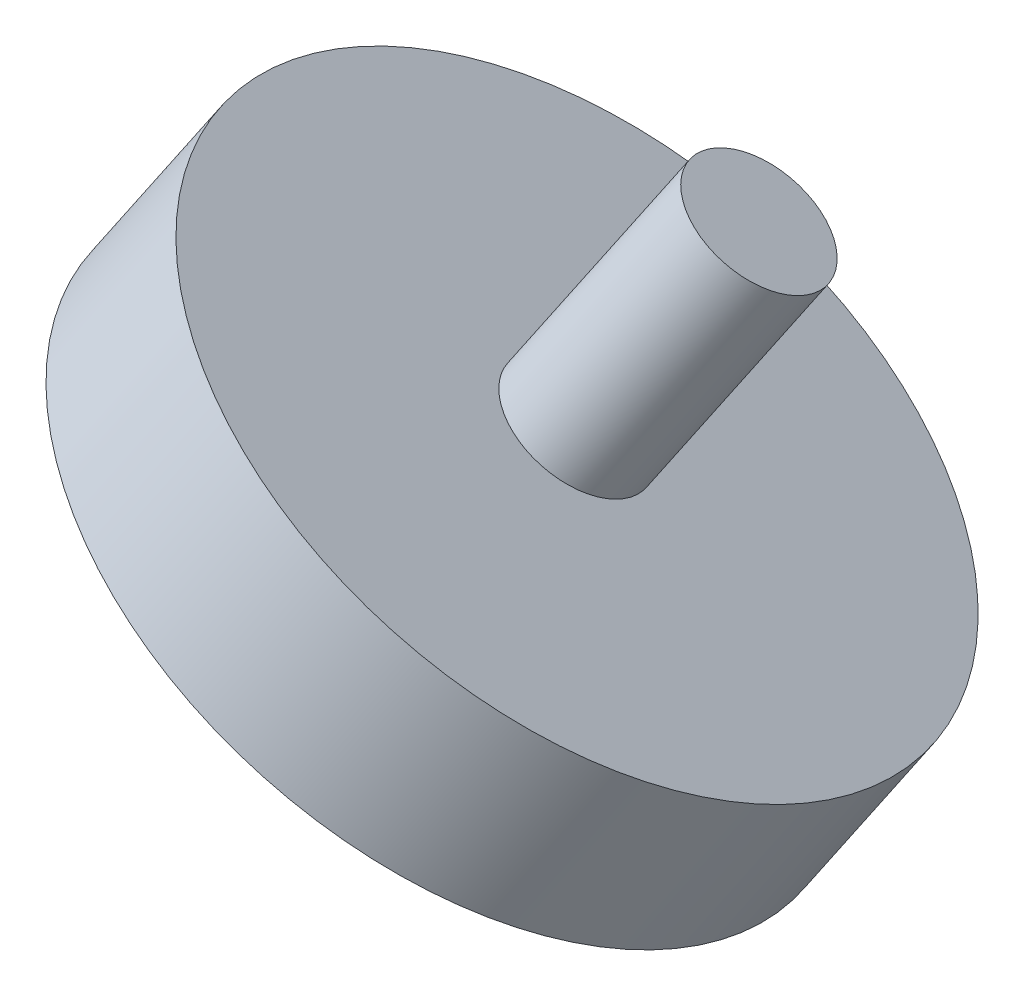
from build123d import *

# Parameters (mm, degrees)
SKETCH1_R           = 10
BOSS_EXTRUDE1_DEPTH = 5
SKETCH2_R           = 1.95
BOSS_EXTRUDE2_DEPTH = 7


with BuildPart() as part:
    # Sketch1 → Boss-Extrude1 (new body)
    with BuildSketch(Plane(origin=(-109.434541397, -193.452902775, 69.684877721), x_dir=(0.8794168923998651, -0.46981927431759296, 0.07678397516054071), z_dir=(0.4698192743176199, 0.8305229887778682, -0.29916787025204106))):
        with Locations((52.987730107, -483.544948633)):
            Circle(SKETCH1_R)
    extrude(amount=BOSS_EXTRUDE1_DEPTH)

    # Sketch2 → Boss-Extrude2 (add)
    with BuildSketch(Plane(origin=(-107.085445025, -189.300287832, 68.18903837), x_dir=(0.879416892399865, -0.4698192743175933, 0.07678397516054022), z_dir=(0.46981927431762005, 0.8305229887778681, -0.2991678702520411))):
        with Locations((52.987730107, -483.544948633)):
            Circle(SKETCH2_R)
    extrude(amount=BOSS_EXTRUDE2_DEPTH)


solid = part.part
